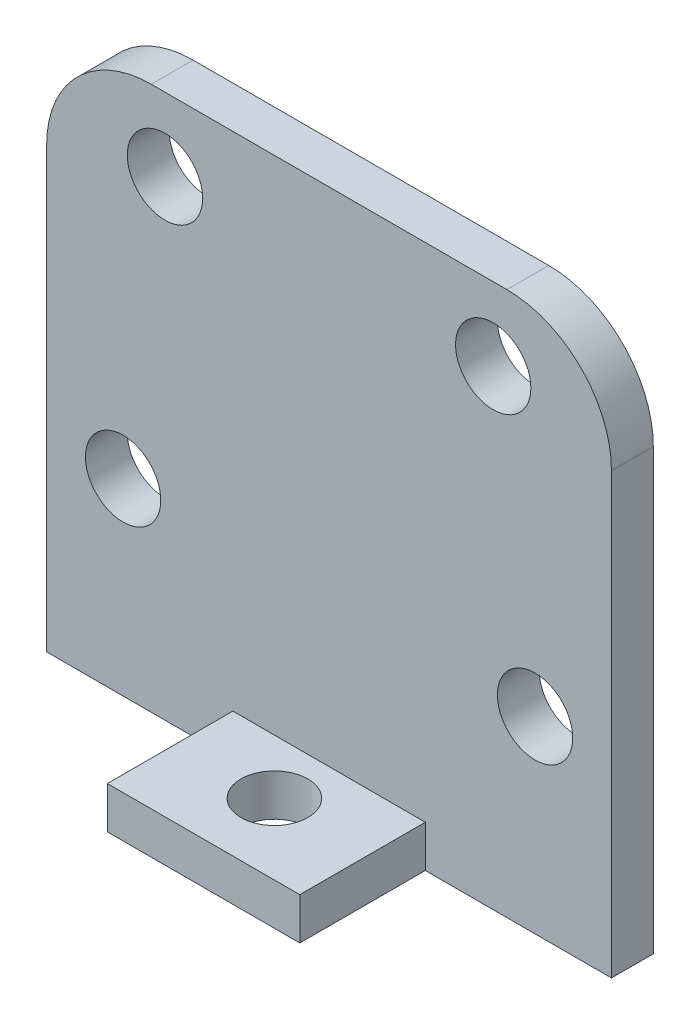
from build123d import *

# Parameters (mm, degrees)
SKETCH1_W           = 27
SKETCH1_H           = 26
BOSS_EXTRUDE1_DEPTH = 2
SKETCH2_W           = 27
SKETCH2_H           = 2
BOSS_EXTRUDE2_DEPTH = 6
CUT_EXTRUDE1_REACH  = 32.369
SKETCH3_R           = 1.6
CUT_EXTRUDE2_REACH  = 30.675
SKETCH4_W           = 8.9
SKETCH4_H           = 6
CUT_EXTRUDE3_REACH  = 32.369
SKETCH5_R           = 1.8
FILLET1_R           = 5


with BuildPart() as part:
    # Sketch1 → Boss-Extrude1 (new body)
    with BuildSketch(Plane.XY):
        with Locations((0, 13)):
            Rectangle(SKETCH1_W, SKETCH1_H)
    extrude(amount=BOSS_EXTRUDE1_DEPTH)

    # Sketch2 → Boss-Extrude2 (add)
    with BuildSketch(Plane.XY.offset(2)):
        with Locations((0, 1)):
            Rectangle(SKETCH2_W, SKETCH2_H)
    extrude(amount=BOSS_EXTRUDE2_DEPTH)

    # Sketch3 → Cut-Extrude1 (cut, up to next)
    with BuildSketch(Plane.XZ, mode=Mode.PRIVATE) as cut_extrude1_sk1:
        with Locations((0, 4.614954576)):
            Circle(SKETCH3_R)
    cut_extrude1_tool1 = extrude(cut_extrude1_sk1.sketch, amount=-CUT_EXTRUDE1_REACH, mode=Mode.PRIVATE) & part.part
    add(cut_extrude1_tool1.solids().sort_by_distance((0, 0, 4.614955))[0], mode=Mode.SUBTRACT)

    # Sketch4 → Cut-Extrude2 (cut, up to next)
    with BuildSketch(Plane(origin=(0, 2, 0), x_dir=(1, 0, 0), z_dir=(0, 1, 0)), mode=Mode.PRIVATE) as cut_extrude2_sk1:
        with Locations((9.05, -5)):
            Rectangle(SKETCH4_W, SKETCH4_H)
    cut_extrude2_tool1 = extrude(cut_extrude2_sk1.sketch, amount=-CUT_EXTRUDE2_REACH, mode=Mode.PRIVATE) & part.part
    cut_extrude2 = cut_extrude2_tool1.solids().sort_by_distance((9.05, 2, 5))[0]
    add(cut_extrude2, mode=Mode.SUBTRACT)

    # Mirror1: Cut-Extrude2 across plane
    add(cut_extrude2.mirror(Plane(origin=(0, 0, 0), x_dir=(0, 0, 1), z_dir=(1, 0, 0))), mode=Mode.SUBTRACT)

    # Sketch5 → Cut-Extrude3 (cut, up to next)
    with BuildSketch(Plane(origin=(0, 0, 0), x_dir=(-1, 0, 0), z_dir=(0, 0, -1)), mode=Mode.PRIVATE) as cut_extrude3_sk1:
        with Locations((-7.845874534, 22.5)):
            Circle(SKETCH5_R)
    cut_extrude3_tool1 = extrude(cut_extrude3_sk1.sketch, amount=-CUT_EXTRUDE3_REACH, mode=Mode.PRIVATE) & part.part
    # Sketch5 → Cut-Extrude3 (cut, up to next)
    with BuildSketch(Plane(origin=(0, 0, 0), x_dir=(-1, 0, 0), z_dir=(0, 0, -1)), mode=Mode.PRIVATE) as cut_extrude3_sk2:
        with Locations((7.845874534, 22.5)):
            Circle(SKETCH5_R)
    cut_extrude3_tool2 = extrude(cut_extrude3_sk2.sketch, amount=-CUT_EXTRUDE3_REACH, mode=Mode.PRIVATE) & part.part
    # Sketch5 → Cut-Extrude3 (cut, up to next)
    with BuildSketch(Plane(origin=(0, 0, 0), x_dir=(-1, 0, 0), z_dir=(0, 0, -1)), mode=Mode.PRIVATE) as cut_extrude3_sk3:
        with Locations((-9.846580197, 9)):
            Circle(SKETCH5_R)
    cut_extrude3_tool3 = extrude(cut_extrude3_sk3.sketch, amount=-CUT_EXTRUDE3_REACH, mode=Mode.PRIVATE) & part.part
    # Sketch5 → Cut-Extrude3 (cut, up to next)
    with BuildSketch(Plane(origin=(0, 0, 0), x_dir=(-1, 0, 0), z_dir=(0, 0, -1)), mode=Mode.PRIVATE) as cut_extrude3_sk4:
        with Locations((9.846580197, 9)):
            Circle(SKETCH5_R)
    cut_extrude3_tool4 = extrude(cut_extrude3_sk4.sketch, amount=-CUT_EXTRUDE3_REACH, mode=Mode.PRIVATE) & part.part
    add(cut_extrude3_tool1.solids().sort_by_distance((7.845875, 22.5, 0))[0], mode=Mode.SUBTRACT)
    add(cut_extrude3_tool2.solids().sort_by_distance((-7.845875, 22.5, 0))[0], mode=Mode.SUBTRACT)
    add(cut_extrude3_tool3.solids().sort_by_distance((9.84658, 9, 0))[0], mode=Mode.SUBTRACT)
    add(cut_extrude3_tool4.solids().sort_by_distance((-9.84658, 9, 0))[0], mode=Mode.SUBTRACT)

    # Fillet1
    fillet1_edges = [part.edges().sort_by_distance(p)[0] for p in [
        (-13.5, 26, 1),
        (13.5, 26, 1),
    ]]
    fillet(fillet1_edges, radius=FILLET1_R)


solid = part.part
